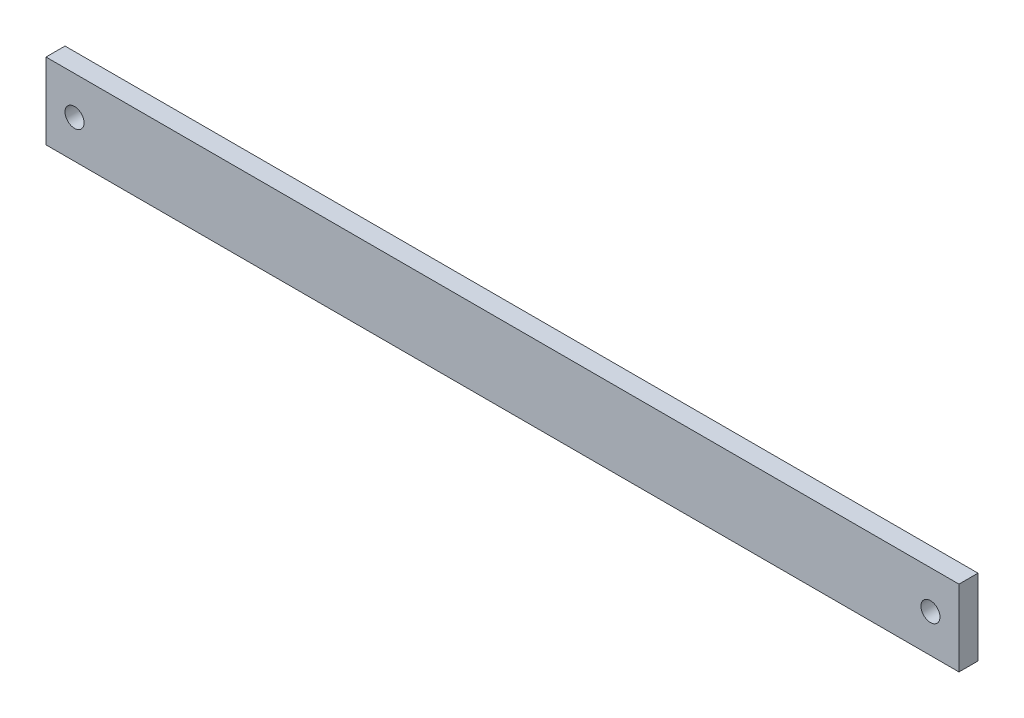
from build123d import *

# Parameters (mm, degrees)
SKETCH1_W          = 304.8
SKETCH1_H          = 25.4
EXTRUDE1_DEPTH     = 6.35
SKETCH2_R          = 3.175
CUT_EXTRUDE1_DEPTH = 344.678167949


with BuildPart() as part:
    # Sketch1 → Extrude1 (new body)
    with BuildSketch(Plane.XY):
        with Locations((0, 295.275)):
            Rectangle(SKETCH1_W, SKETCH1_H)
    extrude(amount=EXTRUDE1_DEPTH)

    # Sketch2 → Cut-Extrude1 (cut, through all)
    with BuildSketch(Plane.XY.offset(6.35)):
        with Locations((142.875, 295.275)):
            Circle(SKETCH2_R)
        with Locations((-142.875, 295.275)):
            Circle(SKETCH2_R)
    extrude(amount=-CUT_EXTRUDE1_DEPTH, mode=Mode.SUBTRACT)


solid = part.part
